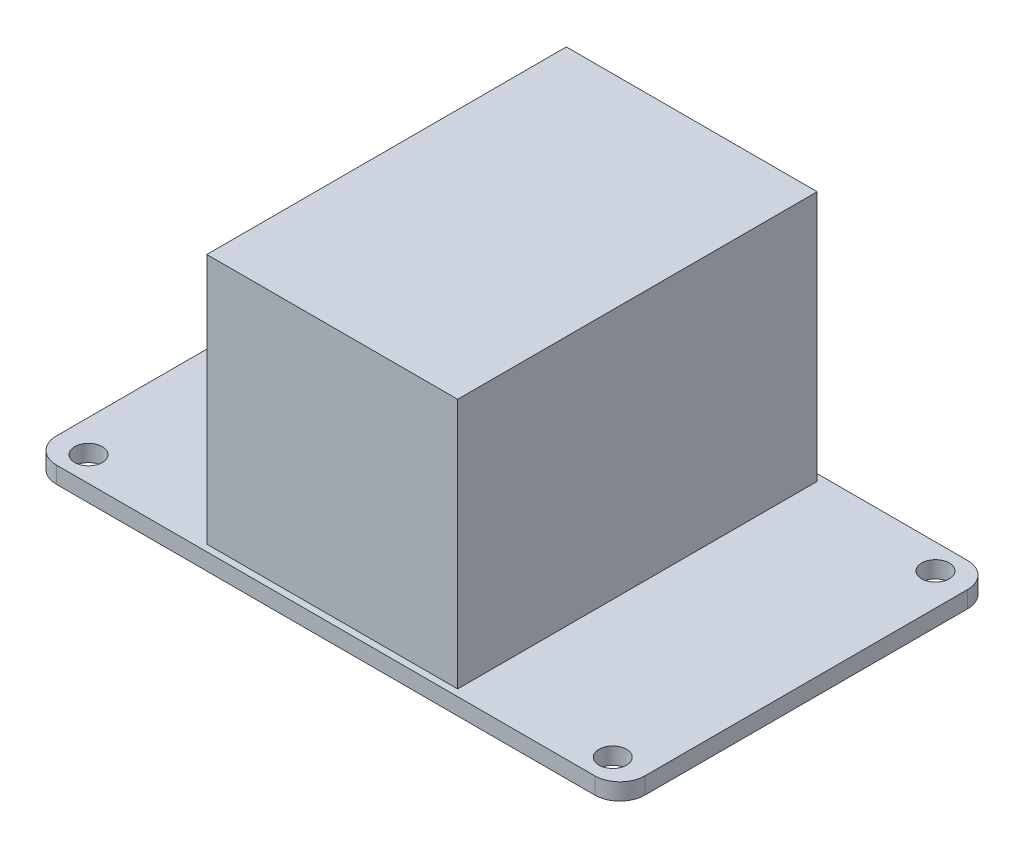
from build123d import *

# Parameters (mm, degrees)
SKETCH1_W           = 70.4
SKETCH1_H           = 44.6
BOSS_EXTRUDE1_DEPTH = 2
SKETCH3_R           = 1.65
CUT_EXTRUDE1_DEPTH  = 42.717262614
FILLET1_R           = 3
SKETCH4_W           = 30
SKETCH4_H           = 43
BOSS_EXTRUDE2_DEPTH = 30


with BuildPart() as part:
    # Sketch1 → Boss-Extrude1 (new body)
    with BuildSketch(Plane(origin=(0, 0, 0), x_dir=(1, 0, 0), z_dir=(0, 1, 0))):
        Rectangle(SKETCH1_W, SKETCH1_H)
    extrude(amount=BOSS_EXTRUDE1_DEPTH)

    # Sketch3 → Cut-Extrude1 (cut, through all)
    with BuildSketch(Plane(origin=(0, 2, 0), x_dir=(1, 0, 0), z_dir=(0, 1, 0))):
        with Locations((-31.35, 19.3)):
            Circle(SKETCH3_R)
        with Locations((31.35, 19.3)):
            Circle(SKETCH3_R)
        with Locations((31.35, -19.3)):
            Circle(SKETCH3_R)
        with Locations((-31.35, -19.3)):
            Circle(SKETCH3_R)
    extrude(amount=-CUT_EXTRUDE1_DEPTH, mode=Mode.SUBTRACT)

    # Fillet1
    fillet1_edges = [part.edges().sort_by_distance(p)[0] for p in [
        (35.2, 1, -22.3),
        (35.2, 1, 22.3),
        (-35.2, 1, -22.3),
        (-35.2, 1, 22.3),
    ]]
    fillet(fillet1_edges, radius=FILLET1_R)

    # Sketch4 → Boss-Extrude2 (add)
    with BuildSketch(Plane(origin=(0, 2, 0), x_dir=(1, 0, 0), z_dir=(0, 1, 0))):
        Rectangle(SKETCH4_W, SKETCH4_H)
    extrude(amount=BOSS_EXTRUDE2_DEPTH)


solid = part.part
